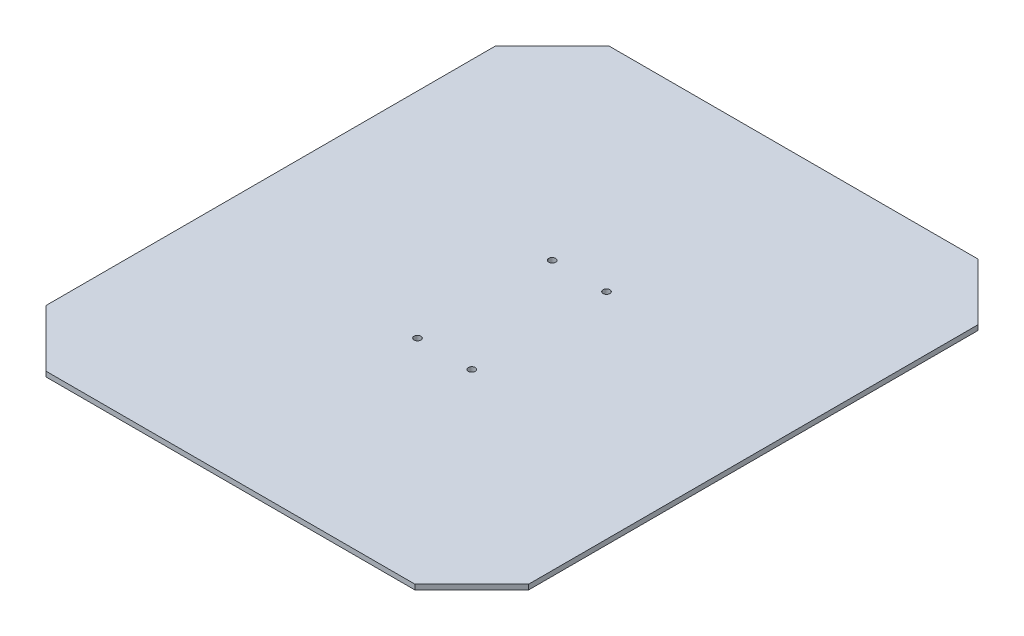
from build123d import *

# Parameters (mm, degrees)
BOSS_EXTRUDE1_DEPTH = 3.175
SKETCH2_R           = 2.159
CUT_EXTRUDE1_DEPTH  = 351.937720963


with BuildPart() as part:
    # Sketch1 → Boss-Extrude1 (new body)
    with BuildSketch(Plane(origin=(0, 0, 0), x_dir=(1, 0, 0), z_dir=(0, 1, 0))):
        Polygon((-25.845025354, 102.456360067), (-61.766049839, 66.535335583), (-61.766049839, -217.222615449), (-25.845025354, -253.143639933), (207.112925677, -253.143639933), (243.033950161, -217.222615449), (243.033950161, 66.535335583), (207.112925677, 102.456360067), align=None)
    extrude(amount=BOSS_EXTRUDE1_DEPTH)

    # Sketch2 → Cut-Extrude1 (cut, through all)
    with BuildSketch(Plane(origin=(0, 3.175, 0), x_dir=(1, 0, 0), z_dir=(0, 1, 0))):
        with Locations((73.361950161, -32.671639933)):
            Circle(SKETCH2_R)
        with Locations((107.651950161, -32.671639933)):
            Circle(SKETCH2_R)
        with Locations((73.361950161, -117.761639933)):
            Circle(SKETCH2_R)
        with Locations((107.651950161, -117.761639933)):
            Circle(SKETCH2_R)
    extrude(amount=-CUT_EXTRUDE1_DEPTH, mode=Mode.SUBTRACT)


solid = part.part
